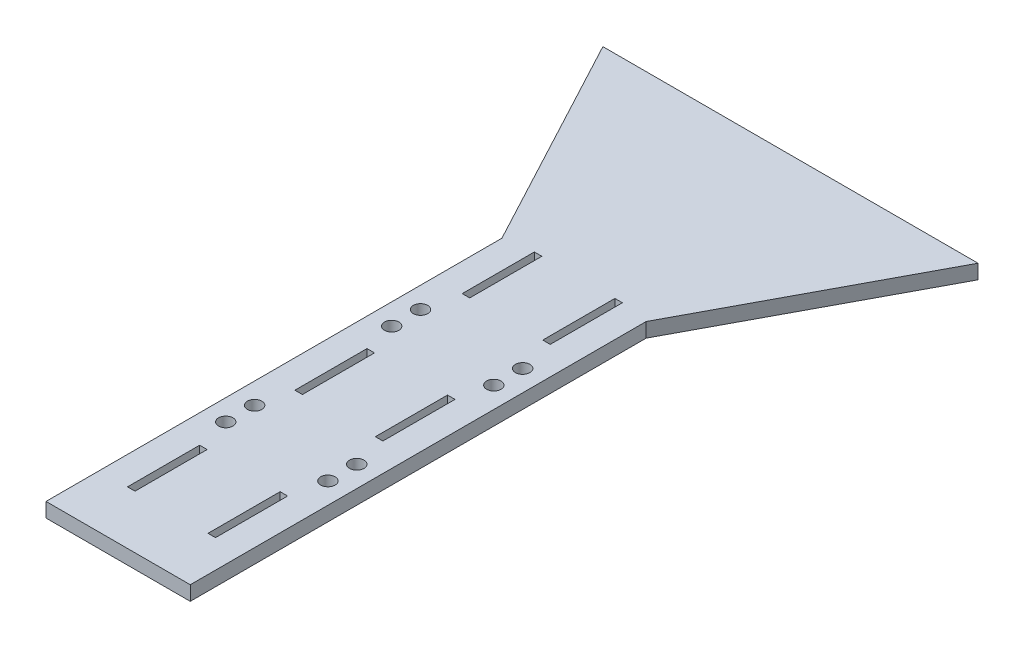
from build123d import *

# Parameters (mm, degrees)
BOSS_EXTRUDE1_DEPTH = 6.35
SKETCH2_W           = 3.302
SKETCH2_H           = 31.75
CUT_EXTRUDE1_DEPTH  = 308.274393824
SKETCH3_R           = 3.175
CUT_EXTRUDE2_DEPTH  = 308.274393824


with BuildPart() as part:
    # Sketch1 → Boss-Extrude1 (new body)
    with BuildSketch(Plane(origin=(0, 0, 0), x_dir=(1, 0, 0), z_dir=(0, 1, 0))):
        Polygon((-31.75, 0), (31.75, 0), (31.75, 200.66), (82.55, 295.91), (-82.55, 295.91), (-31.75, 200.66), align=None)
    extrude(amount=BOSS_EXTRUDE1_DEPTH)

    # Sketch2 → Cut-Extrude1 (cut, through all)
    with BuildSketch(Plane(origin=(0, 6.35, 0), x_dir=(1, 0, 0), z_dir=(0, 1, 0))):
        with Locations((-17.7165, 39.37)):
            Rectangle(SKETCH2_W, SKETCH2_H)
        with Locations((-17.7165, 113.03)):
            Rectangle(SKETCH2_W, SKETCH2_H)
        with Locations((-17.7165, 186.69)):
            Rectangle(SKETCH2_W, SKETCH2_H)
        with Locations((17.7165, 39.37)):
            Rectangle(SKETCH2_W, SKETCH2_H)
        with Locations((17.7165, 113.03)):
            Rectangle(SKETCH2_W, SKETCH2_H)
        with Locations((17.7165, 186.69)):
            Rectangle(SKETCH2_W, SKETCH2_H)
    extrude(amount=-CUT_EXTRUDE1_DEPTH, mode=Mode.SUBTRACT)

    # Sketch3 → Cut-Extrude2 (cut, through all)
    with BuildSketch(Plane(origin=(0, 6.35, 0), x_dir=(1, 0, 0), z_dir=(0, 1, 0))):
        with Locations((-22.479, 155.575)):
            Circle(SKETCH3_R)
        with Locations((-22.479, 142.875)):
            Circle(SKETCH3_R)
        with Locations((22.479, 142.875)):
            Circle(SKETCH3_R)
        with Locations((22.479, 155.575)):
            Circle(SKETCH3_R)
        with Locations((-22.479, 69.85)):
            Circle(SKETCH3_R)
        with Locations((-22.479, 82.55)):
            Circle(SKETCH3_R)
        with Locations((22.479, 69.85)):
            Circle(SKETCH3_R)
        with Locations((22.479, 82.55)):
            Circle(SKETCH3_R)
    extrude(amount=-CUT_EXTRUDE2_DEPTH, mode=Mode.SUBTRACT)


solid = part.part
